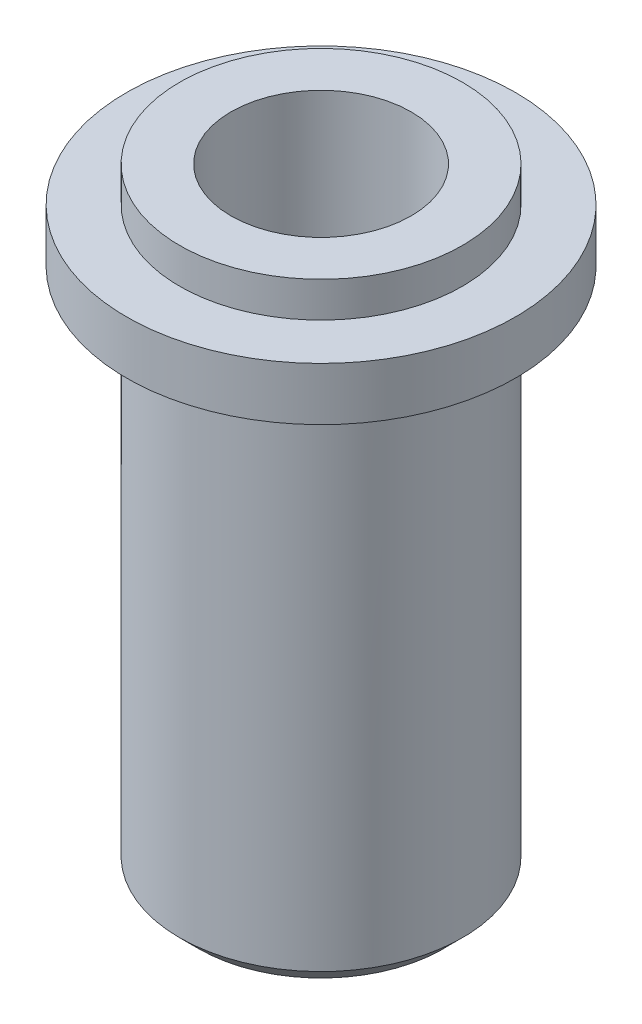
from build123d import *

# Parameters (mm, degrees)
HOLE_WIZARD_M12_1_D = 10.2


# Read off the part's stored shape, not the designer's step: M16 机械螺纹 螺柱1
with BuildPart() as part:
    # 草图1 → 旋转1 (revolve)
    with BuildSketch(Plane.XY, mode=Mode.PRIVATE) as revolve_1_sk:
        Polygon((5, 0), (5, 35), (8, 35), (8, 33), (11, 33), (11, 30), (7, 30), (7, 29), (8, 29), (8, 0), align=None)
    revolve(revolve_1_sk.sketch.rotate(Axis((0, 0, 0), (0, 1, 0)), 90), axis=Axis((0, 0, 0), (0, 1, 0)))

    # M16 机械螺纹 螺柱1 outline → M16 机械螺纹 螺柱1 (revolve, cut)
    with BuildSketch(Plane.XY):
        Polygon((8, 1.0825), (6.9175, 0), (8, 0), align=None)
    revolve(axis=Axis((0, 0, 0), (0, 1, 0)), mode=Mode.SUBTRACT)

    # M12 螺纹孔1 (through all)
    with Locations(Plane(origin=(0, 35, 0), x_dir=(1, 0, 0), z_dir=(0, 1, 0))):
        with Locations((0, 0)):
            Hole(HOLE_WIZARD_M12_1_D / 2)


solid = part.part
